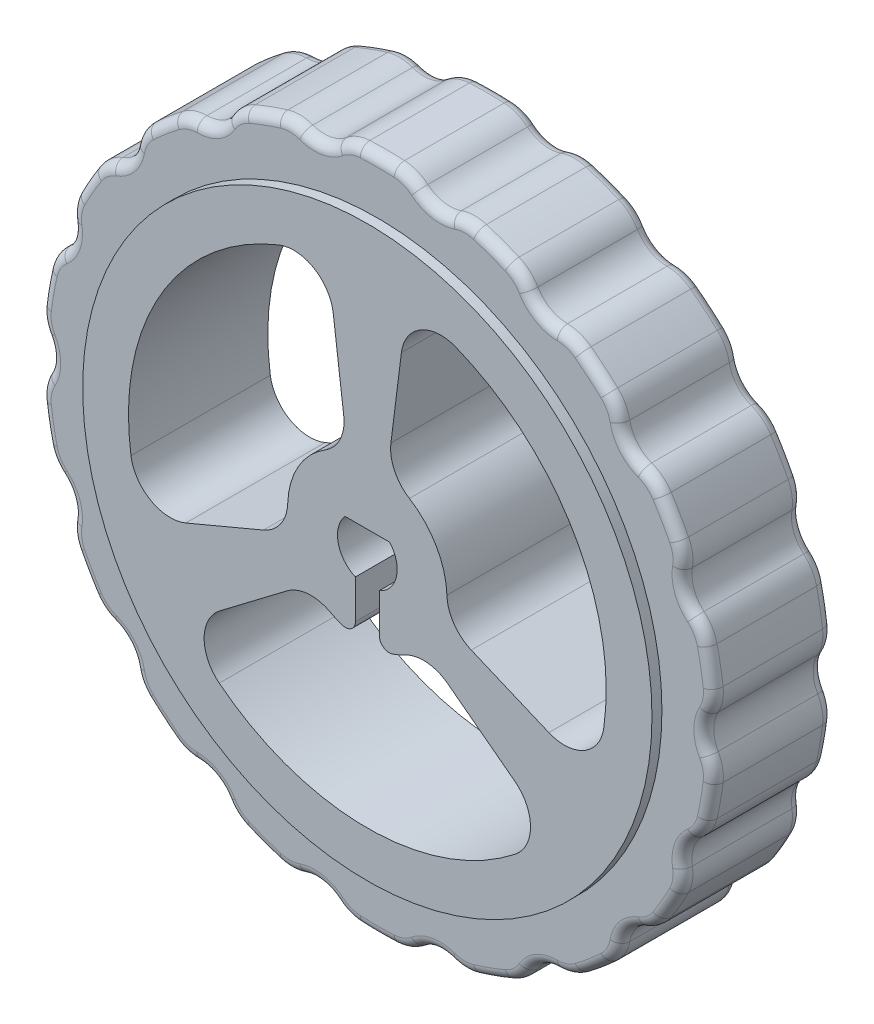
from build123d import *
from build123d.topology import SkipClean

# Parameters (mm, degrees)
SKETCH_1_R          = 17
EXTRUDE_1_DEPTH     = 3
SKETCH_3_R          = 14.3
EXTRUDE_2_DEPTH     = 3.5
SKETCH_4_R          = 23.157926122
CUT_EXTRUDE_2_DEPTH = 7
FILLET_1_R          = 2
FILLET_2_R          = 0.5
FILLET_3_R          = 2
FILLET_4_R          = 0.5
FILLET_5_R          = 2


with BuildPart() as part:
    # 草图1 → 凸台-拉伸1 (new, symmetric)
    with BuildSketch(Plane.XY):
        Circle(SKETCH_1_R)
        with BuildLine():
            Line((-2, 11.832159566), (-1, 3.872983346))
            ThreePointArc((-1, 3.872983346), (-3.464101615, 2), (-3.854101966, -1.070466269))
            Line((-3.854101966, -1.070466269), (-11.246950766, -4.184028976))
            ThreePointArc((-11.246950766, -4.184028976), (-10.392304845, 6), (-2, 11.832159566))
        make_face(mode=Mode.SUBTRACT)
        with BuildLine():
            Line((2, 11.832159566), (1, 3.872983346))
            ThreePointArc((1, 3.872983346), (3.464101615, 2), (3.854101966, -1.070466269))
            Line((3.854101966, -1.070466269), (11.246950766, -4.184028976))
            ThreePointArc((11.246950766, -4.184028976), (10.392304845, 6), (2, 11.832159566))
        make_face(mode=Mode.SUBTRACT)
        with BuildLine():
            Line((9.246950766, -7.648130591), (2.854101966, -2.802517077))
            ThreePointArc((2.854101966, -2.802517077), (1.820607539, -3.56165526), (0.6, -3.954743987))
            Line((0.6, -3.954743987), (0.6, -1.374772708))
            ThreePointArc((0.6, -1.374772708), (1.465536267, -0.319692742), (1.118033989, 1))
            Line((1.118033989, 1), (-1.118033989, 1))
            ThreePointArc((-1.118033989, 1), (-1.465536267, -0.319692742), (-0.6, -1.374772708))
            Line((-0.6, -1.374772708), (-0.6, -3.954743987))
            ThreePointArc((-0.6, -3.954743987), (-1.820607539, -3.56165526), (-2.854101966, -2.802517077))
            Line((-2.854101966, -2.802517077), (-9.246950766, -7.648130591))
            ThreePointArc((-9.246950766, -7.648130591), (0, -12), (9.246950766, -7.648130591))
        make_face(mode=Mode.SUBTRACT)
    extrude(amount=EXTRUDE_1_DEPTH, both=True)

    # 草图3 → 凸台-拉伸2 (add, symmetric)
    with SkipClean():  # the faces are left unmerged after this step: merging them gives an invalid solid
        with BuildSketch(Plane.XY):
            Circle(SKETCH_3_R)
            with BuildLine():
                Line((-9.246950766, -7.648130591), (-2.854101966, -2.802517077))
                ThreePointArc((-2.854101966, -2.802517077), (-1.820607539, -3.56165526), (-0.6, -3.954743987))
                Line((-0.6, -3.954743987), (-0.6, -1.374772708))
                ThreePointArc((-0.6, -1.374772708), (-1.465536267, -0.319692742), (-1.118033989, 1))
                Line((-1.118033989, 1), (1.118033989, 1))
                ThreePointArc((1.118033989, 1), (1.465536267, -0.319692742), (0.6, -1.374772708))
                Line((0.6, -1.374772708), (0.6, -3.954743987))
                ThreePointArc((0.6, -3.954743987), (1.820607539, -3.56165526), (2.854101966, -2.802517077))
                Line((2.854101966, -2.802517077), (9.246950766, -7.648130591))
                ThreePointArc((9.246950766, -7.648130591), (0, -12), (-9.246950766, -7.648130591))
            make_face(mode=Mode.SUBTRACT)
            with BuildLine():
                Line((-2, 11.832159566), (-1, 3.872983346))
                ThreePointArc((-1, 3.872983346), (-3.464101615, 2), (-3.854101966, -1.070466269))
                Line((-3.854101966, -1.070466269), (-11.246950766, -4.184028976))
                ThreePointArc((-11.246950766, -4.184028976), (-10.392304845, 6), (-2, 11.832159566))
            make_face(mode=Mode.SUBTRACT)
            with BuildLine():
                Line((1, 3.872983346), (2, 11.832159566))
                ThreePointArc((2, 11.832159566), (10.392304845, 6), (11.246950766, -4.184028976))
                Line((11.246950766, -4.184028976), (3.854101966, -1.070466269))
                ThreePointArc((3.854101966, -1.070466269), (3.464101615, 2), (1, 3.872983346))
            make_face(mode=Mode.SUBTRACT)
        extrude(amount=EXTRUDE_2_DEPTH, both=True)
    add(part.part.scale(1), mode=Mode.REPLACE)  # the faces are merged on a copy

    # 草图4 → 切除-拉伸2 (cut)
    with BuildSketch(Plane.XY.offset(3)):
        Circle(SKETCH_4_R)
        with BuildLine():
            ThreePointArc((-17.143231179, 1.423915057), (-17.860094463, 3.149216532), (-16.596375467, 4.525287913))
            ThreePointArc((-16.596375467, 4.525287913), (-15.410958981, 5.609130351), (-15.622360203, 7.201372856))
            ThreePointArc((-15.622360203, 7.201372856), (-15.705903484, 9.067807604), (-14.047751937, 9.928674375))
            ThreePointArc((-14.047751937, 9.928674375), (-12.563128867, 10.541716799), (-12.217202026, 12.110238809))
            ThreePointArc((-12.217202026, 12.110238809), (-11.65734875, 13.892687253), (-9.804762201, 14.134516175))
            ThreePointArc((-9.804762201, 14.134516175), (-8.2, 14.202816622), (-7.338468977, 15.558431232))
            ThreePointArc((-7.338468977, 15.558431232), (-6.202745713, 17.041903785), (-4.379173441, 16.635526722))
            ThreePointArc((-4.379173441, 16.635526722), (-2.847830114, 16.150847149), (-1.574608266, 17.130047231))
            ThreePointArc((-1.574608266, 17.130047231), (0, 18.135615208), (1.574608266, 17.130047231))
            ThreePointArc((1.574608266, 17.130047231), (2.847830114, 16.150847149), (4.379173441, 16.635526722))
            ThreePointArc((4.379173441, 16.635526722), (6.202745713, 17.041903785), (7.338468977, 15.558431232))
            ThreePointArc((7.338468977, 15.558431232), (8.2, 14.202816622), (9.804762201, 14.134516175))
            ThreePointArc((9.804762201, 14.134516175), (11.65734875, 13.892687253), (12.217202026, 12.110238809))
            ThreePointArc((12.217202026, 12.110238809), (12.563128867, 10.541716799), (14.047751937, 9.928674375))
            ThreePointArc((14.047751937, 9.928674375), (15.705903484, 9.067807604), (15.622360203, 7.201372856))
            ThreePointArc((15.622360203, 7.201372856), (15.410958981, 5.609130351), (16.596375467, 4.525287913))
            ThreePointArc((16.596375467, 4.525287913), (17.860094463, 3.149216532), (17.143231179, 1.423915057))
            ThreePointArc((17.143231179, 1.423915057), (16.4, 0), (17.143231179, -1.423915057))
            ThreePointArc((17.143231179, -1.423915057), (17.860094463, -3.149216532), (16.596375467, -4.525287913))
            ThreePointArc((16.596375467, -4.525287913), (15.410958981, -5.609130351), (15.622360203, -7.201372856))
            ThreePointArc((15.622360203, -7.201372856), (15.705903484, -9.067807604), (14.047751937, -9.928674375))
            ThreePointArc((14.047751937, -9.928674375), (12.563128867, -10.541716799), (12.217202026, -12.110238809))
            ThreePointArc((12.217202026, -12.110238809), (11.65734875, -13.892687253), (9.804762201, -14.134516175))
            ThreePointArc((9.804762201, -14.134516175), (8.2, -14.202816622), (7.338468977, -15.558431232))
            ThreePointArc((7.338468977, -15.558431232), (6.202745713, -17.041903785), (4.379173441, -16.635526722))
            ThreePointArc((4.379173441, -16.635526722), (2.847830114, -16.150847149), (1.574608266, -17.130047231))
            ThreePointArc((1.574608266, -17.130047231), (0, -18.135615208), (-1.574608266, -17.130047231))
            ThreePointArc((-1.574608266, -17.130047231), (-2.847830114, -16.150847149), (-4.379173441, -16.635526722))
            ThreePointArc((-4.379173441, -16.635526722), (-6.202745713, -17.041903785), (-7.338468977, -15.558431232))
            ThreePointArc((-7.338468977, -15.558431232), (-8.2, -14.202816622), (-9.804762201, -14.134516175))
            ThreePointArc((-9.804762201, -14.134516175), (-11.65734875, -13.892687253), (-12.217202026, -12.110238809))
            ThreePointArc((-12.217202026, -12.110238809), (-12.563128867, -10.541716799), (-14.047751937, -9.928674375))
            ThreePointArc((-14.047751937, -9.928674375), (-15.705903484, -9.067807604), (-15.622360203, -7.201372856))
            ThreePointArc((-15.622360203, -7.201372856), (-15.410958981, -5.609130351), (-16.596375467, -4.525287913))
            ThreePointArc((-16.596375467, -4.525287913), (-17.860094463, -3.149216532), (-17.143231179, -1.423915057))
            ThreePointArc((-17.143231179, -1.423915057), (-16.4, 0), (-17.143231179, 1.423915057))
        make_face(mode=Mode.SUBTRACT)
    extrude(amount=-CUT_EXTRUDE_2_DEPTH, mode=Mode.SUBTRACT)

    # 圆角1
    fillet_1_edges = [part.edges().sort_by_distance(p)[0] for p in [
        (-13.802637861, 9.924071144, 0),
        (-12.170105116, 11.869647908, 0),
        (-9.57600471, 14.046356602, 0),
        (-7.376499293, 15.316241647, 0),
        (-4.194364065, 16.474444151, 0),
        (-1.693178789, 16.915470599, 0),
        (1.693178789, 16.915470599, 0),
        (4.194364065, 16.474444151, 0),
        (7.376499293, 15.316241647, 0),
        (9.57600471, 14.046356602, 0),
        (12.170105116, 11.869647908, 0),
        (13.802637861, 9.924071144, 0),
        (15.49581665, 6.991399455, 0),
        (16.364469181, 4.604796243, 0),
        (16.952504003, 1.269885045, 0),
        (16.952504003, -1.269885045, 0),
        (16.364469181, -4.604796243, 0),
        (15.49581665, -6.991399455, 0),
        (13.802637861, -9.924071144, 0),
        (12.170105116, -11.869647908, 0),
        (9.57600471, -14.046356602, 0),
        (7.376499293, -15.316241647, 0),
        (4.194364065, -16.474444151, 0),
        (1.693178789, -16.915470599, 0),
        (-1.693178789, -16.915470599, 0),
        (-4.194364065, -16.474444151, 0),
        (-7.376499293, -15.316241647, 0),
        (-9.57600471, -14.046356602, 0),
        (-12.170105116, -11.869647908, 0),
        (-15.49581665, -6.991399455, 0),
        (-13.802637861, -9.924071144, 0),
        (-16.364469181, -4.604796243, 0),
        (-16.952504003, -1.269885045, 0),
        (-16.952504003, 1.269885045, 0),
        (-16.364469181, 4.604796243, 0),
        (-15.49581665, 6.991399455, 0),
    ]]
    fillet(fillet_1_edges, radius=FILLET_1_R)

    # 圆角2
    fillet_2_edges = [part.edges().sort_by_distance(p)[0] for p in [
        (-16.84788815, -1.452824016, 3),
        (-16.741731801, -2.95201902, 3),
        (-16.328731249, -4.397109113, 3),
        (-15.410958981, -5.609130351, 3),
        (-15.334941092, -7.127525127, 3),
        (-14.722431864, -8.5, 3),
        (-13.840088372, -9.716685988, 3),
        (-12.563128867, -10.541716799, 3),
        (-11.972373819, -11.942541517, 3),
        (-10.927389365, -13.022755533, 3),
        (-9.68212658, -13.86428713, 3),
        (-8.2, -14.202816622, 3),
        (-7.16576157, -15.317111146, 3),
        (-5.814342437, -15.974774553, 3),
        (-4.356357429, -16.339650629, 3),
        (-2.847830114, -16.150847149, 3),
        (-1.49485272, -16.844211115, 3),
        (0, -17, 3),
        (1.49485272, -16.844211115, 3),
        (2.847830114, -16.150847149, 3),
        (4.356357429, -16.339650629, 3),
        (5.814342437, -15.974774553, 3),
        (7.16576157, -15.317111146, 3),
        (8.2, -14.202816622, 3),
        (9.68212658, -13.86428713, 3),
        (10.927389365, -13.022755533, 3),
        (11.972373819, -11.942541517, 3),
        (12.563128867, -10.541716799, 3),
        (13.840088372, -9.716685988, 3),
        (14.722431864, -8.5, 3),
        (15.334941092, -7.127525127, 3),
        (15.410958981, -5.609130351, 3),
        (16.328731249, -4.397109113, 3),
        (16.741731801, -2.95201902, 3),
        (16.84788815, -1.452824016, 3),
        (16.4, 0, 3),
        (16.84788815, 1.452824016, 3),
        (16.741731801, 2.95201902, 3),
        (16.328731249, 4.397109113, 3),
        (15.410958981, 5.609130351, 3),
        (15.334941092, 7.127525127, 3),
        (14.722431864, 8.5, 3),
        (13.840088372, 9.716685988, 3),
        (12.563128867, 10.541716799, 3),
        (11.972373819, 11.942541517, 3),
        (10.927389365, 13.022755533, 3),
        (9.68212658, 13.86428713, 3),
        (8.2, 14.202816622, 3),
        (7.16576157, 15.317111146, 3),
        (5.814342437, 15.974774553, 3),
        (4.356357429, 16.339650629, 3),
        (2.847830114, 16.150847149, 3),
        (1.49485272, 16.844211115, 3),
        (0, 17, 3),
        (-1.49485272, 16.844211115, 3),
        (-2.847830114, 16.150847149, 3),
        (-4.356357429, 16.339650629, 3),
        (-5.814342437, 15.974774553, 3),
        (-7.16576157, 15.317111146, 3),
        (-8.2, 14.202816622, 3),
        (-9.68212658, 13.86428713, 3),
        (-10.927389365, 13.022755533, 3),
        (-11.972373819, 11.942541517, 3),
        (-12.563128867, 10.541716799, 3),
        (-13.840088372, 9.716685988, 3),
        (-14.722431864, 8.5, 3),
        (-15.334941092, 7.127525127, 3),
        (-15.410958981, 5.609130351, 3),
        (-16.328731249, 4.397109113, 3),
        (-16.741731801, 2.95201902, 3),
        (-16.84788815, 1.452824016, 3),
        (-16.4, 0, 3),
        (-16.84788815, -1.452824016, -3),
        (-16.741731801, -2.95201902, -3),
        (-16.328731249, -4.397109113, -3),
        (-15.410958981, -5.609130351, -3),
        (-15.334941092, -7.127525127, -3),
        (-14.722431864, -8.5, -3),
        (-13.840088372, -9.716685988, -3),
        (-12.563128867, -10.541716799, -3),
        (-11.972373819, -11.942541517, -3),
        (-10.927389365, -13.022755533, -3),
        (-9.68212658, -13.86428713, -3),
        (-8.2, -14.202816622, -3),
        (-7.16576157, -15.317111146, -3),
        (-5.814342437, -15.974774553, -3),
        (-4.356357429, -16.339650629, -3),
        (-2.847830114, -16.150847149, -3),
        (-1.49485272, -16.844211115, -3),
        (0, -17, -3),
        (1.49485272, -16.844211115, -3),
        (2.847830114, -16.150847149, -3),
        (4.356357429, -16.339650629, -3),
        (5.814342437, -15.974774553, -3),
        (7.16576157, -15.317111146, -3),
        (8.2, -14.202816622, -3),
        (9.68212658, -13.86428713, -3),
        (10.927389365, -13.022755533, -3),
        (11.972373819, -11.942541517, -3),
        (12.563128867, -10.541716799, -3),
        (13.840088372, -9.716685988, -3),
        (14.722431864, -8.5, -3),
        (15.334941092, -7.127525127, -3),
        (15.410958981, -5.609130351, -3),
        (16.328731249, -4.397109113, -3),
        (16.741731801, -2.95201902, -3),
        (16.84788815, -1.452824016, -3),
        (16.4, 0, -3),
        (16.84788815, 1.452824016, -3),
        (16.741731801, 2.95201902, -3),
        (16.328731249, 4.397109113, -3),
        (15.410958981, 5.609130351, -3),
        (15.334941092, 7.127525127, -3),
        (14.722431864, 8.5, -3),
        (13.840088372, 9.716685988, -3),
        (12.563128867, 10.541716799, -3),
        (11.972373819, 11.942541517, -3),
        (10.927389365, 13.022755533, -3),
        (9.68212658, 13.86428713, -3),
        (8.2, 14.202816622, -3),
        (7.16576157, 15.317111146, -3),
        (5.814342437, 15.974774553, -3),
        (4.356357429, 16.339650629, -3),
        (2.847830114, 16.150847149, -3),
        (1.49485272, 16.844211115, -3),
        (0, 17, -3),
        (-1.49485272, 16.844211115, -3),
        (-2.847830114, 16.150847149, -3),
        (-4.356357429, 16.339650629, -3),
        (-5.814342437, 15.974774553, -3),
        (-7.16576157, 15.317111146, -3),
        (-8.2, 14.202816622, -3),
        (-9.68212658, 13.86428713, -3),
        (-10.927389365, 13.022755533, -3),
        (-11.972373819, 11.942541517, -3),
        (-12.563128867, 10.541716799, -3),
        (-13.840088372, 9.716685988, -3),
        (-14.722431864, 8.5, -3),
        (-15.334941092, 7.127525127, -3),
        (-15.410958981, 5.609130351, -3),
        (-16.328731249, 4.397109113, -3),
        (-16.741731801, 2.95201902, -3),
        (-16.84788815, 1.452824016, -3),
        (-16.4, 0, -3),
    ]]
    fillet(fillet_2_edges, radius=FILLET_2_R)

    # 圆角3
    fillet_3_edges = [part.edges().sort_by_distance(p)[0] for p in [
        (2.854101966, -2.802517077, 0),
        (-2.854101966, -2.802517077, 0),
        (-3.854101966, -1.070466269, 0),
        (-1, 3.872983346, 0),
        (1, 3.872983346, 0),
        (3.854101966, -1.070466269, 0),
    ]]
    fillet(fillet_3_edges, radius=FILLET_3_R)

    # 圆角4
    fillet_4_edges = [part.edges().sort_by_distance(p)[0] for p in [
        (-0.6, -3.954743987, 0),
        (0.6, -3.954743987, 0),
    ]]
    fillet(fillet_4_edges, radius=FILLET_4_R)

    # 圆角5
    fillet_5_edges = [part.edges().sort_by_distance(p)[0] for p in [
        (-9.246950766, -7.648130591, 0),
        (-11.246950766, -4.184028976, 0),
        (-2, 11.832159566, 0),
        (2, 11.832159566, 0),
        (11.246950766, -4.184028976, 0),
        (9.246950766, -7.648130591, 0),
    ]]
    fillet(fillet_5_edges, radius=FILLET_5_R)


solid = part.part
